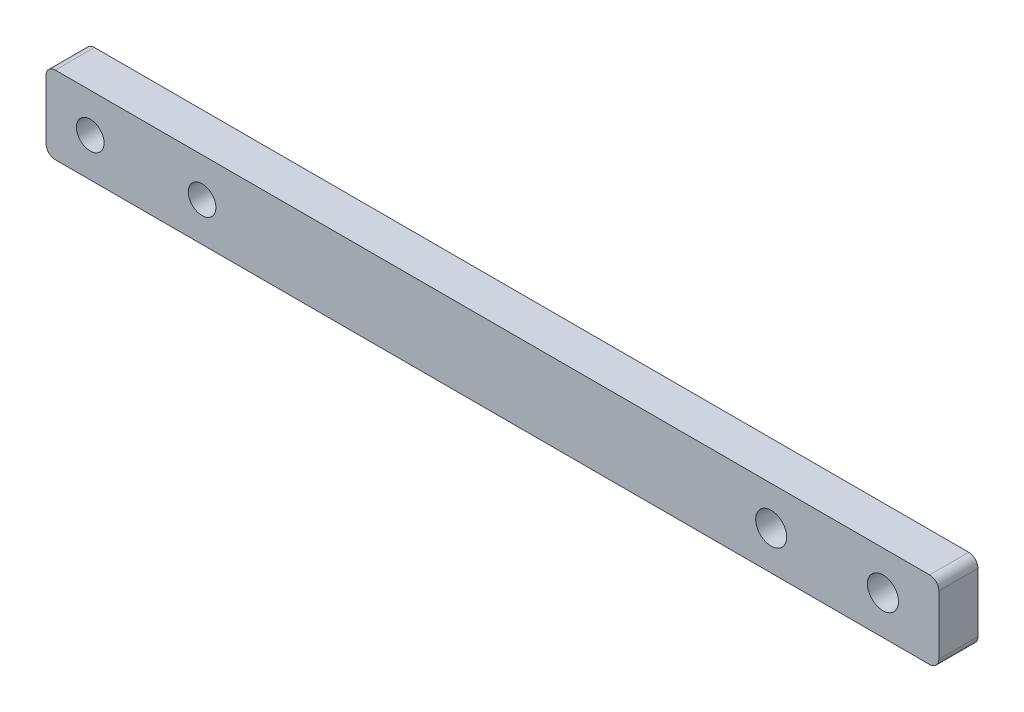
from build123d import *

# Parameters (mm, degrees)
SKETCH1_W           = 73.025
SKETCH1_H           = 6.35
SKETCH1_R           = 1.27
SKETCH1_R_2         = 1.1303
BOSS_EXTRUDE1_DEPTH = 3.2004
FILLET1_R           = 0.762


with BuildPart() as part:
    # Sketch1 → Boss-Extrude1 (new body)
    with BuildSketch(Plane.XY):
        with Locations((36.5125, 3.175)):
            Rectangle(SKETCH1_W, SKETCH1_H)
        with Locations((59.309, 3.175)):
            Circle(SKETCH1_R, mode=Mode.SUBTRACT)
        with Locations((68.453, 3.175)):
            Circle(SKETCH1_R, mode=Mode.SUBTRACT)
        with Locations((3.6195, 3.175)):
            Circle(SKETCH1_R_2, mode=Mode.SUBTRACT)
        with Locations((12.7635, 3.175)):
            Circle(SKETCH1_R_2, mode=Mode.SUBTRACT)
    extrude(amount=BOSS_EXTRUDE1_DEPTH)

    # Fillet1
    fillet1_edges = [part.edges().sort_by_distance(p)[0] for p in [
        (0, 0, 1.6002),
        (73.025, 0, 1.6002),
        (73.025, 6.35, 1.6002),
        (0, 6.35, 1.6002),
    ]]
    fillet(fillet1_edges, radius=FILLET1_R)


solid = part.part
